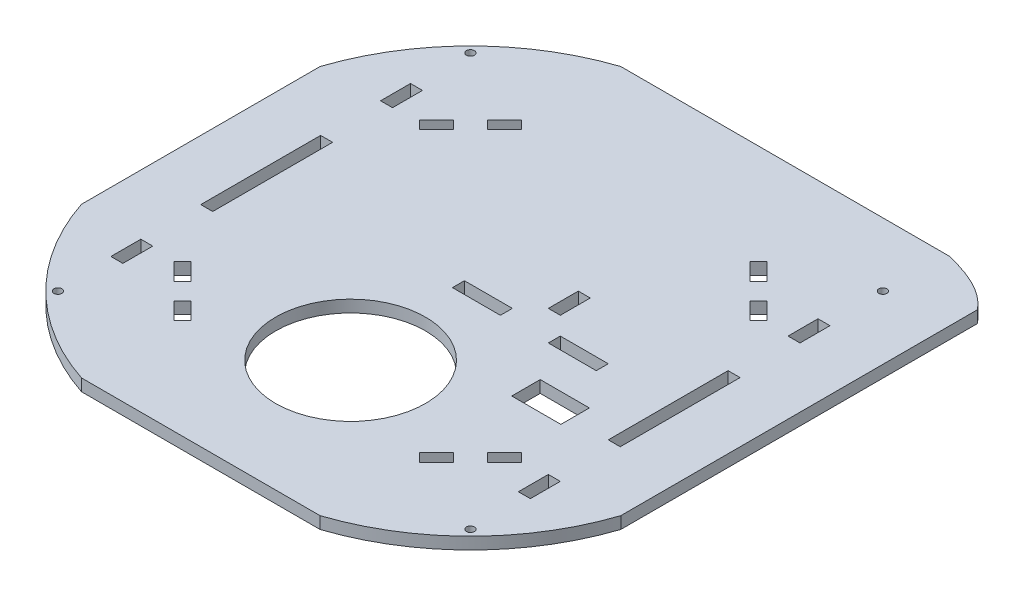
from build123d import *

# Parameters (mm, degrees)
SKETCH1_W           = 228.6
SKETCH1_H           = 228.6
BOSS_EXTRUDE1_DEPTH = 5.08
CUT_EXTRUDE2_REACH  = 325.329
SKETCH9_W           = 5.08
SKETCH9_H           = 12.7
SKETCH9_H_2         = 50.8
CUT_EXTRUDE7_START  = -5.08
CUT_EXTRUDE7_DEPTH  = 5.08
CUT_EXTRUDE5_REACH  = 325.329
SKETCH13_R          = 1.7
CUT_EXTRUDE6_REACH  = 325.329
SKETCH16_W          = 5.08
SKETCH16_H          = 12.7
CUT_EXTRUDE8_DEPTH  = 324.329130287
SKETCH17_W          = 20.32
SKETCH17_H          = 5.08
CUT_EXTRUDE9_DEPTH  = 324.329130287
CUT_EXTRUDE10_REACH = 325.329
SKETCH18_R          = 31.75
CUT_EXTRUDE11_REACH = 325.329
SKETCH19_W          = 20.828
SKETCH19_H          = 12.065


# Read off the part's stored shape, not the designer's step: Cut-Extrude7
with BuildPart() as part:
    # Sketch1 → Boss-Extrude1 (new body)
    with BuildSketch(Plane(origin=(0, 0, 0), x_dir=(1, 0, 0), z_dir=(0, 1, 0))):
        with Locations((114.3, 114.3)):
            Rectangle(SKETCH1_W, SKETCH1_H)
    extrude(amount=BOSS_EXTRUDE1_DEPTH)

    # Sketch9 → Cut-Extrude2 (cut, up to next)
    with BuildSketch(Plane(origin=(0, 5.08, 0), x_dir=(1, 0, 0), z_dir=(0, 1, 0)), mode=Mode.PRIVATE) as cut_extrude2_sk1:
        with Locations((27.94, 57.15)):
            Rectangle(SKETCH9_W, SKETCH9_H)
    cut_extrude2_tool1 = extrude(cut_extrude2_sk1.sketch, amount=-CUT_EXTRUDE2_REACH, mode=Mode.PRIVATE) & part.part
    # Sketch9 → Cut-Extrude2 (cut, up to next)
    with BuildSketch(Plane(origin=(0, 5.08, 0), x_dir=(1, 0, 0), z_dir=(0, 1, 0)), mode=Mode.PRIVATE) as cut_extrude2_sk2:
        with Locations((27.94, 171.45)):
            Rectangle(SKETCH9_W, SKETCH9_H)
    cut_extrude2_tool2 = extrude(cut_extrude2_sk2.sketch, amount=-CUT_EXTRUDE2_REACH, mode=Mode.PRIVATE) & part.part
    # Sketch9 → Cut-Extrude2 (cut, up to next)
    with BuildSketch(Plane(origin=(0, 5.08, 0), x_dir=(1, 0, 0), z_dir=(0, 1, 0)), mode=Mode.PRIVATE) as cut_extrude2_sk3:
        with Locations((27.94, 114.3)):
            Rectangle(SKETCH9_W, SKETCH9_H_2)
    cut_extrude2_tool3 = extrude(cut_extrude2_sk3.sketch, amount=-CUT_EXTRUDE2_REACH, mode=Mode.PRIVATE) & part.part
    # Sketch9 → Cut-Extrude2 (cut, up to next)
    with BuildSketch(Plane(origin=(0, 5.08, 0), x_dir=(1, 0, 0), z_dir=(0, 1, 0)), mode=Mode.PRIVATE) as cut_extrude2_sk4:
        with Locations((200.66, 57.15)):
            Rectangle(SKETCH9_W, SKETCH9_H)
    cut_extrude2_tool4 = extrude(cut_extrude2_sk4.sketch, amount=-CUT_EXTRUDE2_REACH, mode=Mode.PRIVATE) & part.part
    # Sketch9 → Cut-Extrude2 (cut, up to next)
    with BuildSketch(Plane(origin=(0, 5.08, 0), x_dir=(1, 0, 0), z_dir=(0, 1, 0)), mode=Mode.PRIVATE) as cut_extrude2_sk5:
        with Locations((200.66, 171.45)):
            Rectangle(SKETCH9_W, SKETCH9_H)
    cut_extrude2_tool5 = extrude(cut_extrude2_sk5.sketch, amount=-CUT_EXTRUDE2_REACH, mode=Mode.PRIVATE) & part.part
    # Sketch9 → Cut-Extrude2 (cut, up to next)
    with BuildSketch(Plane(origin=(0, 5.08, 0), x_dir=(1, 0, 0), z_dir=(0, 1, 0)), mode=Mode.PRIVATE) as cut_extrude2_sk6:
        with Locations((200.66, 114.3)):
            Rectangle(SKETCH9_W, SKETCH9_H_2)
    cut_extrude2_tool6 = extrude(cut_extrude2_sk6.sketch, amount=-CUT_EXTRUDE2_REACH, mode=Mode.PRIVATE) & part.part
    add(cut_extrude2_tool1.solids().sort_by_distance((27.94, 5.08, -57.15))[0], mode=Mode.SUBTRACT)
    add(cut_extrude2_tool2.solids().sort_by_distance((27.94, 5.08, -171.45))[0], mode=Mode.SUBTRACT)
    add(cut_extrude2_tool3.solids().sort_by_distance((27.94, 5.08, -114.3))[0], mode=Mode.SUBTRACT)
    add(cut_extrude2_tool4.solids().sort_by_distance((200.66, 5.08, -57.15))[0], mode=Mode.SUBTRACT)
    add(cut_extrude2_tool5.solids().sort_by_distance((200.66, 5.08, -171.45))[0], mode=Mode.SUBTRACT)
    add(cut_extrude2_tool6.solids().sort_by_distance((200.66, 5.08, -114.3))[0], mode=Mode.SUBTRACT)

    # Cut-Extrude7 outline → Cut-Extrude7 (cut)
    with BuildSketch(Plane.XZ.offset(CUT_EXTRUDE7_START)):
        with BuildLine():
            Line((228.6, -228.6), (228.6, -214.96095324))
            add(Edge.make_bspline(
                [(228.6, -214.96095324), (228.271324847, -215.358272881), (226.828038088, -217.01632419), (224.012197717, -219.629547006), (219.578479693, -222.607192086), (214.100555872, -225.254763581), (208.4056249, -227.207942052), (204.348403214, -228.260486737), (202.903319092, -228.6)],
                knots=[0.418523599, 0.418523599, 0.418523599, 0.418523599, 0.4375, 0.5, 0.5625, 0.625, 0.6875, 0.719133593, 0.719133593, 0.719133593, 0.719133593], degree=3))
            Line((202.903319092, -228.6), (228.6, -228.6))
        make_face()
        with BuildLine():
            ThreePointArc((164.870571061, 0), (204.294023356, -24.305976644), (228.6, -63.729428939))
            Line((228.6, -63.729428939), (228.6, 0))
            Line((228.6, 0), (164.870571061, 0))
        make_face()
        with BuildLine():
            Line((0, -228.6), (63.729428939, -228.6))
            ThreePointArc((63.729428939, -228.6), (24.305976644, -204.294023356), (0, -164.870571061))
            Line((0, -164.870571061), (0, -228.6))
        make_face()
        with BuildLine():
            ThreePointArc((0, -63.729428939), (24.305976644, -24.305976644), (63.729428939, 0))
            Line((63.729428939, 0), (0, 0))
            Line((0, 0), (0, -63.729428939))
        make_face()
    extrude(amount=CUT_EXTRUDE7_DEPTH, mode=Mode.SUBTRACT)

    # Sketch13 → Cut-Extrude5 (cut, up to next)
    with BuildSketch(Plane(origin=(0, 5.08, 0), x_dir=(1, 0, 0), z_dir=(0, 1, 0)), mode=Mode.PRIVATE) as cut_extrude5_sk1:
        with Locations(Location((26.879075631, 26.879075631, 0), (0, 0, 270))):
            Circle(SKETCH13_R)
    cut_extrude5_tool1 = extrude(cut_extrude5_sk1.sketch, amount=-CUT_EXTRUDE5_REACH, mode=Mode.PRIVATE) & part.part
    # Sketch13 → Cut-Extrude5 (cut, up to next)
    with BuildSketch(Plane(origin=(0, 5.08, 0), x_dir=(1, 0, 0), z_dir=(0, 1, 0)), mode=Mode.PRIVATE) as cut_extrude5_sk2:
        with Locations(Location((201.720924369, 201.720924369, 0), (0, 0, 270))):
            Circle(SKETCH13_R)
    cut_extrude5_tool2 = extrude(cut_extrude5_sk2.sketch, amount=-CUT_EXTRUDE5_REACH, mode=Mode.PRIVATE) & part.part
    # Sketch13 → Cut-Extrude5 (cut, up to next)
    with BuildSketch(Plane(origin=(0, 5.08, 0), x_dir=(1, 0, 0), z_dir=(0, 1, 0)), mode=Mode.PRIVATE) as cut_extrude5_sk3:
        with Locations(Location((26.879075631, 201.720924369, 0), (0, 0, 270))):
            Circle(SKETCH13_R)
    cut_extrude5_tool3 = extrude(cut_extrude5_sk3.sketch, amount=-CUT_EXTRUDE5_REACH, mode=Mode.PRIVATE) & part.part
    # Sketch13 → Cut-Extrude5 (cut, up to next)
    with BuildSketch(Plane(origin=(0, 5.08, 0), x_dir=(1, 0, 0), z_dir=(0, 1, 0)), mode=Mode.PRIVATE) as cut_extrude5_sk4:
        with Locations(Location((201.720924369, 26.879075631, 0), (0, 0, 270))):
            Circle(SKETCH13_R)
    cut_extrude5_tool4 = extrude(cut_extrude5_sk4.sketch, amount=-CUT_EXTRUDE5_REACH, mode=Mode.PRIVATE) & part.part
    add(cut_extrude5_tool1.solids().sort_by_distance((26.879076, 5.08, -26.879076))[0], mode=Mode.SUBTRACT)
    add(cut_extrude5_tool2.solids().sort_by_distance((201.720924, 5.08, -201.720924))[0], mode=Mode.SUBTRACT)
    add(cut_extrude5_tool3.solids().sort_by_distance((26.879076, 5.08, -201.720924))[0], mode=Mode.SUBTRACT)
    add(cut_extrude5_tool4.solids().sort_by_distance((201.720924, 5.08, -26.879076))[0], mode=Mode.SUBTRACT)

    # Sketch14 → Cut-Extrude6 (cut, up to next)
    with BuildSketch(Plane.XZ, mode=Mode.PRIVATE) as cut_extrude6_sk1:
        Polygon((169.959013197, -177.143218094), (162.774808301, -184.327422991), (166.366910749, -187.91952544), (173.551115646, -180.735320543), align=None)
    cut_extrude6_tool1 = extrude(cut_extrude6_sk1.sketch, amount=-CUT_EXTRUDE6_REACH, mode=Mode.PRIVATE) & part.part
    # Sketch14 → Cut-Extrude6 (cut, up to next)
    with BuildSketch(Plane.XZ, mode=Mode.PRIVATE) as cut_extrude6_sk2:
        Polygon((184.327422991, -162.774808301), (177.143218094, -169.959013197), (180.735320543, -173.551115646), (187.91952544, -166.366910749), align=None)
    cut_extrude6_tool2 = extrude(cut_extrude6_sk2.sketch, amount=-CUT_EXTRUDE6_REACH, mode=Mode.PRIVATE) & part.part
    # Sketch14 → Cut-Extrude6 (cut, up to next)
    with BuildSketch(Plane.XZ, mode=Mode.PRIVATE) as cut_extrude6_sk3:
        Polygon((65.825191699, -184.327422991), (58.640986803, -177.143218094), (55.048884354, -180.735320543), (62.233089251, -187.91952544), align=None)
    cut_extrude6_tool3 = extrude(cut_extrude6_sk3.sketch, amount=-CUT_EXTRUDE6_REACH, mode=Mode.PRIVATE) & part.part
    # Sketch14 → Cut-Extrude6 (cut, up to next)
    with BuildSketch(Plane.XZ, mode=Mode.PRIVATE) as cut_extrude6_sk4:
        Polygon((51.456781906, -169.959013197), (44.272577009, -162.774808301), (40.68047456, -166.366910749), (47.864679457, -173.551115646), align=None)
    cut_extrude6_tool4 = extrude(cut_extrude6_sk4.sketch, amount=-CUT_EXTRUDE6_REACH, mode=Mode.PRIVATE) & part.part
    # Sketch14 → Cut-Extrude6 (cut, up to next)
    with BuildSketch(Plane.XZ, mode=Mode.PRIVATE) as cut_extrude6_sk5:
        Polygon((177.143218094, -58.640986803), (184.327422991, -65.825191699), (187.91952544, -62.233089251), (180.735320543, -55.048884354), align=None)
    cut_extrude6_tool5 = extrude(cut_extrude6_sk5.sketch, amount=-CUT_EXTRUDE6_REACH, mode=Mode.PRIVATE) & part.part
    # Sketch14 → Cut-Extrude6 (cut, up to next)
    with BuildSketch(Plane.XZ, mode=Mode.PRIVATE) as cut_extrude6_sk6:
        Polygon((162.774808301, -44.272577009), (169.959013197, -51.456781906), (173.551115646, -47.864679457), (166.366910749, -40.68047456), align=None)
    cut_extrude6_tool6 = extrude(cut_extrude6_sk6.sketch, amount=-CUT_EXTRUDE6_REACH, mode=Mode.PRIVATE) & part.part
    # Sketch14 → Cut-Extrude6 (cut, up to next)
    with BuildSketch(Plane.XZ, mode=Mode.PRIVATE) as cut_extrude6_sk7:
        Polygon((44.272577009, -65.825191699), (51.456781906, -58.640986803), (47.864679457, -55.048884354), (40.68047456, -62.233089251), align=None)
    cut_extrude6_tool7 = extrude(cut_extrude6_sk7.sketch, amount=-CUT_EXTRUDE6_REACH, mode=Mode.PRIVATE) & part.part
    # Sketch14 → Cut-Extrude6 (cut, up to next)
    with BuildSketch(Plane.XZ, mode=Mode.PRIVATE) as cut_extrude6_sk8:
        Polygon((58.640986803, -51.456781906), (65.825191699, -44.272577009), (62.233089251, -40.68047456), (55.048884354, -47.864679457), align=None)
    cut_extrude6_tool8 = extrude(cut_extrude6_sk8.sketch, amount=-CUT_EXTRUDE6_REACH, mode=Mode.PRIVATE) & part.part
    add(cut_extrude6_tool1.solids().sort_by_distance((168.162962, 0, -182.531372))[0], mode=Mode.SUBTRACT)
    add(cut_extrude6_tool2.solids().sort_by_distance((182.531372, 0, -168.162962))[0], mode=Mode.SUBTRACT)
    add(cut_extrude6_tool3.solids().sort_by_distance((60.437038, 0, -182.531372))[0], mode=Mode.SUBTRACT)
    add(cut_extrude6_tool4.solids().sort_by_distance((46.068628, 0, -168.162962))[0], mode=Mode.SUBTRACT)
    add(cut_extrude6_tool5.solids().sort_by_distance((182.531372, 0, -60.437038))[0], mode=Mode.SUBTRACT)
    add(cut_extrude6_tool6.solids().sort_by_distance((168.162962, 0, -46.068628))[0], mode=Mode.SUBTRACT)
    add(cut_extrude6_tool7.solids().sort_by_distance((46.068628, 0, -60.437038))[0], mode=Mode.SUBTRACT)
    add(cut_extrude6_tool8.solids().sort_by_distance((60.437038, 0, -46.068628))[0], mode=Mode.SUBTRACT)

    # Sketch16 → Cut-Extrude8 (cut, through all)
    with BuildSketch(Plane.XZ):
        with Locations((139.7, -130.81)):
            Rectangle(SKETCH16_W, SKETCH16_H)
    extrude(amount=-CUT_EXTRUDE8_DEPTH, mode=Mode.SUBTRACT)

    # Sketch17 → Cut-Extrude9 (cut, through all)
    with BuildSketch(Plane.XZ):
        with Locations((119.38, -114.3)):
            Rectangle(SKETCH17_W, SKETCH17_H)
        with Locations((160.02, -114.3)):
            Rectangle(SKETCH17_W, SKETCH17_H)
    extrude(amount=-CUT_EXTRUDE9_DEPTH, mode=Mode.SUBTRACT)

    # Sketch18 → Cut-Extrude10 (cut, up to next)
    with BuildSketch(Plane(origin=(0, 5.08, 0), x_dir=(1, 0, 0), z_dir=(0, 1, 0)), mode=Mode.PRIVATE) as cut_extrude10_sk1:
        with Locations(Location((114.3, 63.5, 0), (0, 0, 270))):
            Circle(SKETCH18_R)
    cut_extrude10_tool1 = extrude(cut_extrude10_sk1.sketch, amount=-CUT_EXTRUDE10_REACH, mode=Mode.PRIVATE) & part.part
    add(cut_extrude10_tool1.solids().sort_by_distance((114.3, 5.08, -63.5))[0], mode=Mode.SUBTRACT)

    # Sketch19 → Cut-Extrude11 (cut, up to next)
    with BuildSketch(Plane(origin=(0, 5.08, 0), x_dir=(1, 0, 0), z_dir=(0, 1, 0)), mode=Mode.PRIVATE) as cut_extrude11_sk1:
        with Locations((171.988363225, 90.574772783)):
            Rectangle(SKETCH19_W, SKETCH19_H)
    cut_extrude11_tool1 = extrude(cut_extrude11_sk1.sketch, amount=-CUT_EXTRUDE11_REACH, mode=Mode.PRIVATE) & part.part
    add(cut_extrude11_tool1.solids().sort_by_distance((171.988363, 5.08, -90.574773))[0], mode=Mode.SUBTRACT)


solid = part.part
